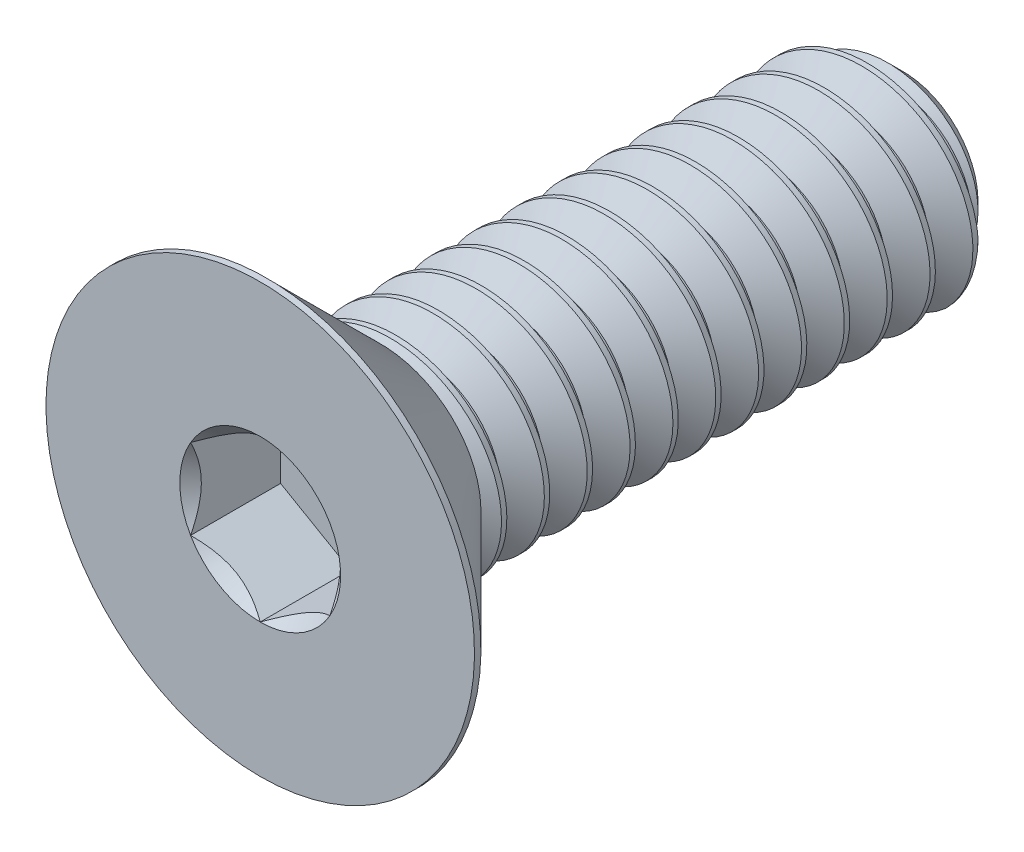
from build123d import *

# Parameters (mm, degrees)
CHAMFER1_SIZE      = 0.3
CUT_EXTRUDE2_DEPTH = 0.84
CUT_SWEEP1_PITCH   = 0.4


with BuildPart() as part:
    # Sketch1 → Revolve1 (revolve)
    with BuildSketch(Plane(origin=(0, 0, 0), x_dir=(0, 0, -1), z_dir=(1, 0, 0)), mode=Mode.PRIVATE) as revolve1_sk:
        Polygon((-1.8, 1), (3, 1), (3, 0), (-2.16, 0), (-2.16, 1), align=None)
    revolve(revolve1_sk.sketch.rotate(Axis((0, 0, 2.16), (0, 0, -1)), 180), axis=Axis((0, 0, 2.16), (0, 0, -1)))

    # Chamfer1
    chamfer1_edges = [part.edges().sort_by_distance(p)[0] for p in [
        (0, 1, -3),
    ]]
    chamfer(chamfer1_edges, length=CHAMFER1_SIZE)

    # Cut-Sweep1: the profile of Sketch13 screwed along a right-hand helix of 15 turns, 6 arcs to a turn; built about Z, then put on its axis
    cut_sweep1_z = Axis((0, 0, 0), (0, 0, 1))
    cut_sweep1_corners = [(1.021650635, 0, 0.0125), (1.021650635, 0, -0.3625), (0.740192379, 0, -0.2), (0.740192379, 0, -0.15)]
    with BuildLine(mode=Mode.PRIVATE) as cut_sweep1_profile:
        Line(cut_sweep1_corners[0], cut_sweep1_corners[1])
        Line(cut_sweep1_corners[1], cut_sweep1_corners[2])
        Line(cut_sweep1_corners[2], cut_sweep1_corners[3])
        Line(cut_sweep1_corners[3], cut_sweep1_corners[0])
    cut_sweep1_cap = Face(cut_sweep1_profile.wire())
    cut_sweep1_turn_angles = [0, 30, 60, 90, 120, 150, 180, 210, 240, 270, 300, 330, 360]
    cut_sweep1_turn_weights = [1, 0.8660254037844387, 1, 0.8660254037844387, 1, 0.8660254037844387, 1, 0.8660254037844387, 1, 0.8660254037844387, 1, 0.8660254037844387, 1]
    cut_sweep1_turn_rails = [Edge.make_bspline([Vector(p[0], p[1], 0).rotate(cut_sweep1_z, cut_sweep1_turn_angles[k]) / cut_sweep1_turn_weights[k] + Vector(0, 0, p[2] + CUT_SWEEP1_PITCH * cut_sweep1_turn_angles[k] / 360) for k in range(13)], [0, 0, 0, 1, 1, 2, 2, 3, 3, 4, 4, 5, 5, 6, 6, 6], 2, cut_sweep1_turn_weights) for p in cut_sweep1_corners]
    cut_sweep1_turn_sides = [Face.make_surface_from_curves(cut_sweep1_turn_rails[p[0]], cut_sweep1_turn_rails[p[1]]) for p in [(0, 1), (1, 2), (2, 3), (3, 0)]]
    cut_sweep1 = Plane(origin=(0, 0, -3), x_dir=(0, 1, 0), z_dir=(0, 0, 1)) * Solid(Shell([*[p.moved(Location((0, 0, CUT_SWEEP1_PITCH * i))) for i in range(15) for p in cut_sweep1_turn_sides], cut_sweep1_cap, cut_sweep1_cap.rotate(cut_sweep1_z, 5400).moved(Location((0, 0, CUT_SWEEP1_PITCH * 5400 / 360)))]))
    add(cut_sweep1, mode=Mode.SUBTRACT)


with BuildPart() as body_2:
    # Sketch7 → Revolve2 (revolve)
    with BuildSketch(Plane(origin=(0, 0, 0), x_dir=(0, 0, -1), z_dir=(1, 0, 0)), mode=Mode.PRIVATE) as revolve2_sk:
        Polygon((-3, 2), (-2.94, 2), (-1.8, 0.86), (-1.8, 0), (-3, 0), align=None)
    revolve(revolve2_sk.sketch.rotate(Axis((0, 0, 3), (0, 0, -1)), 180), axis=Axis((0, 0, 3), (0, 0, -1)))

    # Sketch5 → Cut-Extrude2 (cut)
    with BuildSketch(Plane.XY.offset(3)):
        Polygon((0.65, -0.375277675), (0.65, 0.375277675), (0, 0.75055535), (-0.65, 0.375277675), (-0.65, -0.375277675), (0, -0.75055535), align=None)
    extrude(amount=-CUT_EXTRUDE2_DEPTH, mode=Mode.SUBTRACT)

    # Cut-Extrude3 cone 1 section (through the dimple's axis) → Cut-Extrude3 (revolve, cut)
    with BuildSketch(Plane(origin=(0, 0, 3), x_dir=(0, -1, 0), z_dir=(1, 0, 0))):
        Polygon((0, 0), (0.75055535, 0), (0, 0.75055535), align=None)
    revolve(axis=Axis((0, 0, 3), (0, 0, -1)), mode=Mode.SUBTRACT)

    # Combine1: union part
    add(part.part)


solid = body_2.part
